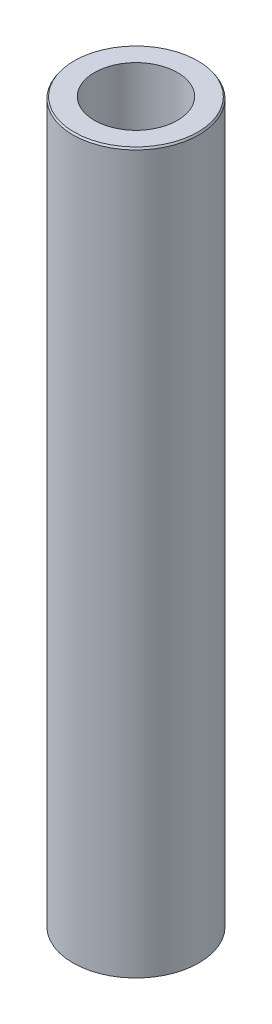
from build123d import *
from OCP.BRepFilletAPI import BRepFilletAPI_MakeChamfer

# Parameters (mm, degrees)
SKETCH1_R           = 52.5
BOSS_EXTRUDE1_DEPTH = 600
SKETCH2_R           = 34.58177338
CUT_EXTRUDE1_DEPTH  = 605.576297914
CHAMFER1_SIZE       = 1.488434371
CHAMFER1_SIZE2      = 1.000049078


with BuildPart() as part:
    # Sketch1 → Boss-Extrude1 (new body)
    with BuildSketch(Plane(origin=(0, 0, 0), x_dir=(1, 0, 0), z_dir=(0, 1, 0))):
        Circle(SKETCH1_R)
    extrude(amount=BOSS_EXTRUDE1_DEPTH)

    # Sketch2 → Cut-Extrude1 (cut, through all)
    with BuildSketch(Plane(origin=(0, 0, 0), x_dir=(1, 0, 0), z_dir=(0, 1, 0))):
        Circle(SKETCH2_R)
    extrude(amount=CUT_EXTRUDE1_DEPTH, mode=Mode.SUBTRACT)

    # Chamfer1: one chamfer whose edges measure the first distance from different faces: ONE call of the kernel's chamfer builder (chamfer() names one face for all edges)
    chamfer1_edges_1 = [part.edges().sort_by_distance(p)[0] for p in [
        (-52.5, 600, 0),
    ]]
    chamfer1_side_1 = [part.faces().sort_by_distance(p)[0] for p in [
        (-52.5, 300, 0),
    ]]
    chamfer1_edges_2 = [part.edges().sort_by_distance(p)[0] for p in [
        (-52.5, 0, 0),
    ]]
    chamfer1_side_2 = [part.faces().sort_by_distance(p)[0] for p in [
        (-51.01507576, 0, 0),
    ]]
    chamfer1 = BRepFilletAPI_MakeChamfer(part.part.solid().wrapped)
    for e in chamfer1_edges_1:
        chamfer1.Add(CHAMFER1_SIZE, CHAMFER1_SIZE2, e.wrapped, chamfer1_side_1[0].wrapped)  # the first distance lies on this face
    for e in chamfer1_edges_2:
        chamfer1.Add(CHAMFER1_SIZE, CHAMFER1_SIZE2, e.wrapped, chamfer1_side_2[0].wrapped)  # the first distance lies on this face
    add(Compound.cast(chamfer1.Shape()), mode=Mode.REPLACE)


solid = part.part
